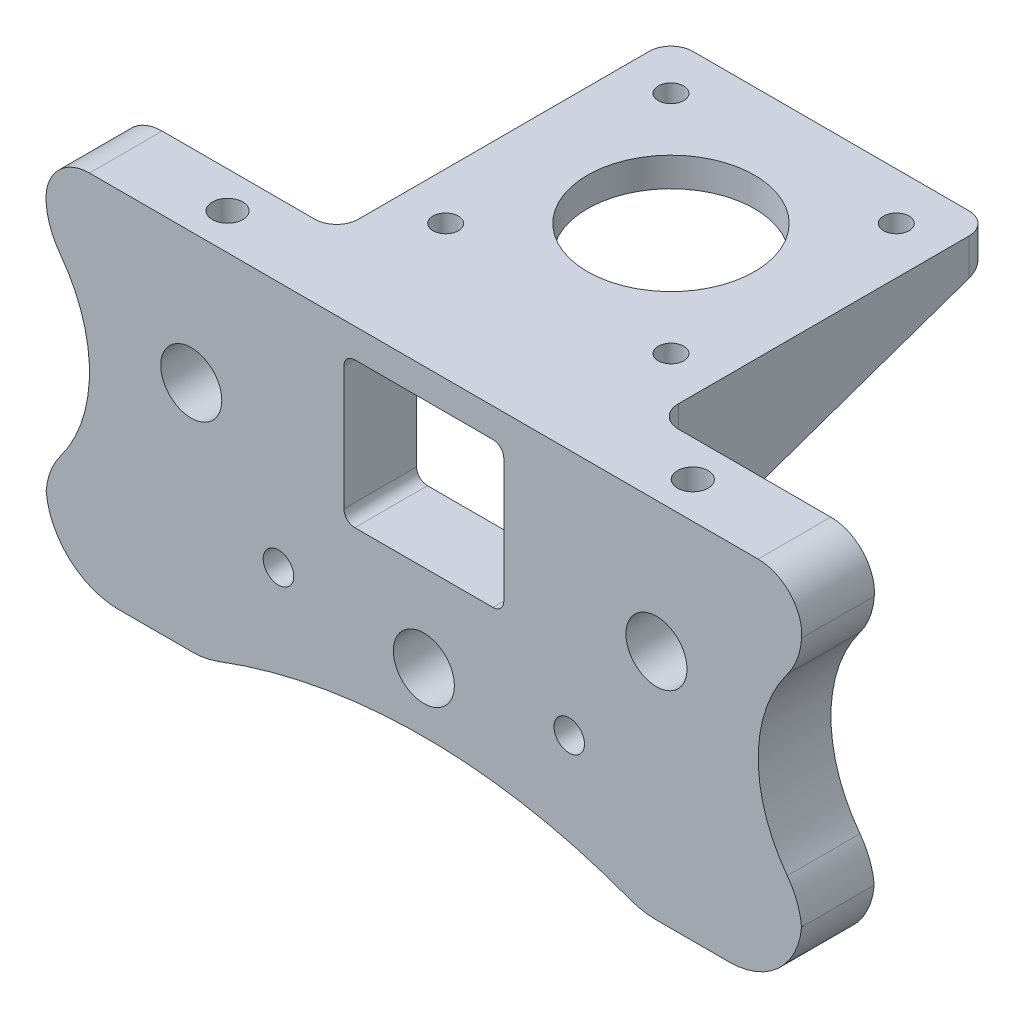
from build123d import *

# Parameters (mm, degrees)
SKETCH1_R           = 4.2
BOSS_EXTRUDE1_DEPTH = 5
FILLET1_R           = 10
FILLET2_R           = 6
SKETCH2_W           = 42
SKETCH2_H           = 46
SKETCH2_R           = 11.5
SKETCH2_R_2         = 1.75
BOSS_EXTRUDE2_DEPTH = 4
CUT_EXTRUDE1_REACH  = 89.139
CUT_EXTRUDE1_START  = -1
SKETCH3_R           = 3
CUT_EXTRUDE2_REACH  = 90.34
SKETCH4_R           = 1.75
SKETCH5_R           = 2.1
CUT_EXTRUDE3_DEPTH  = 4
BOSS_EXTRUDE3_START = -2
BOSS_EXTRUDE3_DEPTH = 3
FILLET3_R           = 2
FILLET4_R           = 3
SKETCH7_R           = 1.75
CUT_EXTRUDE4_DEPTH  = 81.398748245
SKETCH8_R           = 2.1
CUT_EXTRUDE5_DEPTH  = 4
CHAMFER1_SIZE       = 0.5


with BuildPart() as part:
    # Sketch1 → Boss-Extrude1 (new, symmetric)
    with BuildSketch(Plane.XY):
        with BuildLine():
            Line((-52, 25), (52, 25))
            Line((52, 25), (52, 15.565713714))
            ThreePointArc((52, 15.565713714), (46, 1.282856857), (52, -13))
            Line((52, -13), (52, -25))
            Line((52, -25), (30, -25))
            ThreePointArc((30, -25), (0, -19.161984871), (-30, -25))
            Line((-30, -25), (-52, -25))
            Line((-52, -25), (-52, -13))
            ThreePointArc((-52, -13), (-46, 1.282856857), (-52, 15.565713714))
            Line((-52, 15.565713714), (-52, 25))
        make_face()
        with Locations((0, -11)):
            Circle(SKETCH1_R, mode=Mode.SUBTRACT)
        with Locations((-32, 7)):
            Circle(SKETCH1_R, mode=Mode.SUBTRACT)
        with Locations((32, 7)):
            Circle(SKETCH1_R, mode=Mode.SUBTRACT)
        with BuildLine():
            Line((-9.5, 21), (9.5, 21))
            ThreePointArc((9.5, 21), (10.560660172, 20.560660172), (11, 19.5))
            Line((11, 19.5), (11, 2.5))
            ThreePointArc((11, 2.5), (10.560660172, 1.439339828), (9.5, 1))
            Line((9.5, 1), (-9.5, 1))
            ThreePointArc((-9.5, 1), (-10.560660172, 1.439339828), (-11, 2.5))
            Line((-11, 2.5), (-11, 19.5))
            ThreePointArc((-11, 19.5), (-10.560660172, 20.560660172), (-9.5, 21))
        make_face(mode=Mode.SUBTRACT)
    extrude(amount=BOSS_EXTRUDE1_DEPTH, both=True)

    # Fillet1
    # the kernel refuses this fillet: 10 mm, written as the material it takes off along each edge
    with BuildSketch(Plane(origin=(52, 15.565713714, 14.292857857), x_dir=(-0.6589710561597435, -0.7521682970876347, 0), z_dir=(0, 0, -1))) as fillet1_piece_1:
        with BuildLine():
            CenterArc((3.793793334, 9.971172714), FILLET1_R, 228.778553177, 36.869897646)
            Line((-2.795917228, 2.449489743), (0, 0))
            ThreePointArc((0, 0), (1.517517334, 0.057654573), (3.035034667, 0))
        make_face()
    extrude(amount=28.585715715, mode=Mode.SUBTRACT)
    with BuildSketch(Plane(origin=(52, -13, 14.292857857), x_dir=(0, -1, 0), z_dir=(0, 0, -1)), Plane(origin=(-52, -13, -14.292857857), x_dir=(0, -1, 0), z_dir=(0, 0, 1))) as fillet1_piece_2:
        with BuildLine():
            CenterArc((3.717143143, 10), FILLET1_R, 233.130102354, 36.869897646)
            ThreePointArc((-2.282856857, 2), (-1.103435734, 1.043365942), (0, 0))
            Line((0, 0), (3.717143143, 0))
        make_face()
    extrude(amount=28.585715715, mode=Mode.SUBTRACT)
    with BuildSketch(Plane(origin=(52, -25, 30), x_dir=(-1, 0, 0), z_dir=(0, 0, -1))) as fillet1_piece_3:
        with BuildLine():
            CenterArc((FILLET1_R, FILLET1_R), FILLET1_R, 180, 90)
            Line((0, FILLET1_R), (0, 0))
            Line((0, 0), (FILLET1_R, 0))
        make_face()
    extrude(amount=60, mode=Mode.SUBTRACT)
    with BuildSketch(Plane(origin=(30, -25, 9.716697693), x_dir=(-0.931136532102541, 0.3646707536724787, 0), z_dir=(0, 0, -1))) as fillet1_piece_4:
        with BuildLine():
            CenterArc((1.889951723, 9.999382002), FILLET1_R, 248.612678269, 20.750330625)
            Line((-1.756755813, 0.688016681), (0, 0))
            ThreePointArc((0, 0), (0.889389046, 0.004943983), (1.778778093, 0))
        make_face()
    extrude(amount=19.433395387, mode=Mode.SUBTRACT)
    with BuildSketch(Plane(origin=(-30, -25, 9.716697693), x_dir=(-1, 0, 0), z_dir=(0, 0, -1))) as fillet1_piece_5:
        with BuildLine():
            CenterArc((1.886679077, 10), FILLET1_R, 249.249669375, 20.750330625)
            ThreePointArc((-1.656285265, 0.648668348), (-0.826339706, 0.328937697), (0, 0))
            Line((0, 0), (1.886679077, 0))
        make_face()
    extrude(amount=19.433395387, mode=Mode.SUBTRACT)
    with BuildSketch(Plane(origin=(-52, -25, -30), x_dir=(0, 1, 0), z_dir=(0, 0, 1))) as fillet1_piece_6:
        with BuildLine():
            CenterArc((FILLET1_R, -FILLET1_R), FILLET1_R, 90, 90)
            Line((0, -FILLET1_R), (0, 0))
            Line((0, 0), (FILLET1_R, 0))
        make_face()
    extrude(amount=60, mode=Mode.SUBTRACT)
    with BuildSketch(Plane(origin=(-52, 15.565713714, -14.292857857), x_dir=(0, 1, 0), z_dir=(0, 0, 1))) as fillet1_piece_7:
        with BuildLine():
            CenterArc((3.717143143, -10), FILLET1_R, 90, 36.869897646)
            ThreePointArc((-2.282856857, -2), (-1.103435734, -1.043365942), (0, 0))
            Line((0, 0), (3.717143143, 0))
        make_face()
    extrude(amount=28.585715715, mode=Mode.SUBTRACT)

    # Fillet2
    fillet2_edges = [part.edges().sort_by_distance(p)[0] for p in [
        (52, 25, 0),
        (-52, 25, 0),
    ]]
    fillet(fillet2_edges, radius=FILLET2_R)

    # Sketch2 → Boss-Extrude2 (add)
    with BuildSketch(Plane(origin=(0, 25, -30), x_dir=(-1, 0, 0), z_dir=(0, 1, 0))):
        with Locations((0, 2)):
            Rectangle(SKETCH2_W, SKETCH2_H)
        with Locations(Location((0, 1, 0), (0, 0, 90))):
            Circle(SKETCH2_R, mode=Mode.SUBTRACT)
        with Locations(Location((15.5, 16.5, 0), (0, 0, 90))):
            Circle(SKETCH2_R_2, mode=Mode.SUBTRACT)
        with Locations(Location((-15.5, 16.5, 0), (0, 0, 90))):
            Circle(SKETCH2_R_2, mode=Mode.SUBTRACT)
        with Locations(Location((-15.5, -14.5, 0), (0, 0, 90))):
            Circle(SKETCH2_R_2, mode=Mode.SUBTRACT)
        with Locations(Location((15.5, -14.5, 0), (0, 0, 90))):
            Circle(SKETCH2_R_2, mode=Mode.SUBTRACT)
    extrude(amount=-BOSS_EXTRUDE2_DEPTH)

    # Sketch3 → Cut-Extrude1 (cut, up to next)
    with BuildSketch(Plane.XZ.offset(-21).offset(CUT_EXTRUDE1_START), mode=Mode.PRIVATE) as cut_extrude1_sk1:
        with Locations(Location((-15.5, -44.5, 0), (0, 0, 270))):
            Circle(SKETCH3_R)
    cut_extrude1_tool1 = extrude(cut_extrude1_sk1.sketch, amount=CUT_EXTRUDE1_REACH, mode=Mode.PRIVATE) & part.part
    # Sketch3 → Cut-Extrude1 (cut, up to next)
    with BuildSketch(Plane.XZ.offset(-21).offset(CUT_EXTRUDE1_START), mode=Mode.PRIVATE) as cut_extrude1_sk2:
        with Locations(Location((15.5, -44.5, 0), (0, 0, 270))):
            Circle(SKETCH3_R)
    cut_extrude1_tool2 = extrude(cut_extrude1_sk2.sketch, amount=CUT_EXTRUDE1_REACH, mode=Mode.PRIVATE) & part.part
    # Sketch3 → Cut-Extrude1 (cut, up to next)
    with BuildSketch(Plane.XZ.offset(-21).offset(CUT_EXTRUDE1_START), mode=Mode.PRIVATE) as cut_extrude1_sk3:
        with Locations(Location((15.5, -13.5, 0), (0, 0, 270))):
            Circle(SKETCH3_R)
    cut_extrude1_tool3 = extrude(cut_extrude1_sk3.sketch, amount=CUT_EXTRUDE1_REACH, mode=Mode.PRIVATE) & part.part
    # Sketch3 → Cut-Extrude1 (cut, up to next)
    with BuildSketch(Plane.XZ.offset(-21).offset(CUT_EXTRUDE1_START), mode=Mode.PRIVATE) as cut_extrude1_sk4:
        with Locations(Location((-15.5, -13.5, 0), (0, 0, 270))):
            Circle(SKETCH3_R)
    cut_extrude1_tool4 = extrude(cut_extrude1_sk4.sketch, amount=CUT_EXTRUDE1_REACH, mode=Mode.PRIVATE) & part.part
    add(cut_extrude1_tool1.solids().sort_by_distance((-15.5, 22, -44.5))[0], mode=Mode.SUBTRACT)
    add(cut_extrude1_tool2.solids().sort_by_distance((15.5, 22, -44.5))[0], mode=Mode.SUBTRACT)
    add(cut_extrude1_tool3.solids().sort_by_distance((15.5, 22, -13.5))[0], mode=Mode.SUBTRACT)
    add(cut_extrude1_tool4.solids().sort_by_distance((-15.5, 22, -13.5))[0], mode=Mode.SUBTRACT)

    # Sketch4 → Cut-Extrude2 (cut, up to next)
    with BuildSketch(Plane(origin=(0, 25, 0), x_dir=(1, 0, 0), z_dir=(0, 1, 0)), mode=Mode.PRIVATE) as cut_extrude2_sk1:
        with Locations(Location((-32, 0, 0), (0, 0, 270))):
            Circle(SKETCH4_R)
    cut_extrude2_tool1 = extrude(cut_extrude2_sk1.sketch, amount=-CUT_EXTRUDE2_REACH, mode=Mode.PRIVATE) & part.part
    # Sketch4 → Cut-Extrude2 (cut, up to next)
    with BuildSketch(Plane(origin=(0, 25, 0), x_dir=(1, 0, 0), z_dir=(0, 1, 0)), mode=Mode.PRIVATE) as cut_extrude2_sk2:
        with Locations(Location((32, 0, 0), (0, 0, 270))):
            Circle(SKETCH4_R)
    cut_extrude2_tool2 = extrude(cut_extrude2_sk2.sketch, amount=-CUT_EXTRUDE2_REACH, mode=Mode.PRIVATE) & part.part
    add(cut_extrude2_tool1.solids().sort_by_distance((-32, 25, 0))[0], mode=Mode.SUBTRACT)
    add(cut_extrude2_tool2.solids().sort_by_distance((32, 25, 0))[0], mode=Mode.SUBTRACT)

    # Sketch5 → Cut-Extrude3 (cut)
    with BuildSketch(Plane(origin=(0, 25, 0), x_dir=(1, 0, 0), z_dir=(0, 1, 0))):
        with Locations(Location((-32, 0, 0), (0, 0, 270))):
            Circle(SKETCH5_R)
        with Locations(Location((32, 0, 0), (0, 0, 270))):
            Circle(SKETCH5_R)
    extrude(amount=-CUT_EXTRUDE3_DEPTH, mode=Mode.SUBTRACT)

    # Sketch6 → Boss-Extrude3 (add)
    with BuildSketch(Plane(origin=(21, 0, 0), x_dir=(0, 0, -1), z_dir=(1, 0, 0)).offset(BOSS_EXTRUDE3_START)):
        Polygon((51, 25), (5, 25), (5, 5), (51, 21), align=None)
    boss_extrude3 = extrude(amount=BOSS_EXTRUDE3_DEPTH)

    # Mirror1: Boss-Extrude3 across plane
    add(boss_extrude3.mirror(Plane(origin=(0, 0, 0), x_dir=(0, 0, 1), z_dir=(1, 0, 0))))

    # Fillet3
    fillet3_edges = [part.edges().sort_by_distance(p)[0] for p in [
        (-14.25, 21, -5),
        (14.25, 21, -5),
    ]]
    fillet(fillet3_edges, radius=FILLET3_R)

    # Fillet4
    fillet4_edges = [part.edges().sort_by_distance(p)[0] for p in [
        (22, 15, -5),
        (-22, 15, -5),
        (-22, 23, -51),
        (22, 23, -51),
    ]]
    fillet(fillet4_edges, radius=FILLET4_R)

    # Sketch7 → Cut-Extrude4 (cut, through all)
    with BuildSketch(Plane.XY.offset(5)):
        with Locations((-20, -9)):
            Circle(SKETCH7_R)
        with Locations((20, -9)):
            Circle(SKETCH7_R)
    extrude(amount=-CUT_EXTRUDE4_DEPTH, mode=Mode.SUBTRACT)

    # Sketch8 → Cut-Extrude5 (cut)
    with BuildSketch(Plane.XY.offset(5)):
        with Locations((-20, -9)):
            Circle(SKETCH8_R)
        with Locations((20, -9)):
            Circle(SKETCH8_R)
    extrude(amount=-CUT_EXTRUDE5_DEPTH, mode=Mode.SUBTRACT)

    # Chamfer1
    # the kernel refuses this chamfer: 0.5 mm, written as the material it takes off along each edge
    with BuildSketch(Plane(origin=(-32, 21, 0), x_dir=(0, 0, 1), z_dir=(-1, 0, 0))) as chamfer1_piece_1_section:
        Polygon((1.75, -CHAMFER1_SIZE), (1.75 + CHAMFER1_SIZE, 0), (1.75, 0), align=None)
    chamfer1_piece_1 = revolve(axis=Axis((-32, 21, 0), (0, 1, 0)), mode=Mode.PRIVATE)
    chamfer1_piece_1 = chamfer1_piece_1 & Plane(origin=(-32, 20.675956313, 0), x_dir=(0, 0, 1), z_dir=(0, 1, 0)) * Cylinder(2.1, 9, mode=Mode.PRIVATE)
    add(chamfer1_piece_1, mode=Mode.SUBTRACT)
    with BuildSketch(Plane(origin=(32, 21, 0), x_dir=(0, 0, 1), z_dir=(-1, 0, 0))) as chamfer1_piece_2_section:
        Polygon((1.75, -CHAMFER1_SIZE), (1.75 + CHAMFER1_SIZE, 0), (1.75, 0), align=None)
    chamfer1_piece_2 = revolve(axis=Axis((32, 21, 0), (0, 1, 0)), mode=Mode.PRIVATE)
    chamfer1_piece_2 = chamfer1_piece_2 & Plane(origin=(32, 20.675956313, 0), x_dir=(0, 0, 1), z_dir=(0, 1, 0)) * Cylinder(2.1, 10, mode=Mode.PRIVATE)
    add(chamfer1_piece_2, mode=Mode.SUBTRACT)
    with BuildSketch(Plane(origin=(-20, -9, 1), x_dir=(1, 0, 0), z_dir=(0, -1, 0))) as chamfer1_piece_3_section:
        Polygon((1.75, -CHAMFER1_SIZE), (1.75 + CHAMFER1_SIZE, 0), (1.75, 0), align=None)
    chamfer1_piece_3 = revolve(axis=Axis((-20, -9, 1), (0, 0, 1)), mode=Mode.PRIVATE)
    chamfer1_piece_3 = chamfer1_piece_3 & Plane(origin=(-20, -9, 0.675956313), x_dir=(1, 0, 0), z_dir=(0, 0, 1)) * Cylinder(2.1, 9, mode=Mode.PRIVATE)
    add(chamfer1_piece_3, mode=Mode.SUBTRACT)
    with BuildSketch(Plane(origin=(20, -9, 1), x_dir=(1, 0, 0), z_dir=(0, -1, 0))) as chamfer1_piece_4_section:
        Polygon((1.75, -CHAMFER1_SIZE), (1.75 + CHAMFER1_SIZE, 0), (1.75, 0), align=None)
    chamfer1_piece_4 = revolve(axis=Axis((20, -9, 1), (0, 0, 1)), mode=Mode.PRIVATE)
    chamfer1_piece_4 = chamfer1_piece_4 & Plane(origin=(20, -9, 0.675956313), x_dir=(1, 0, 0), z_dir=(0, 0, 1)) * Cylinder(2.1, 9, mode=Mode.PRIVATE)
    add(chamfer1_piece_4, mode=Mode.SUBTRACT)


solid = part.part
